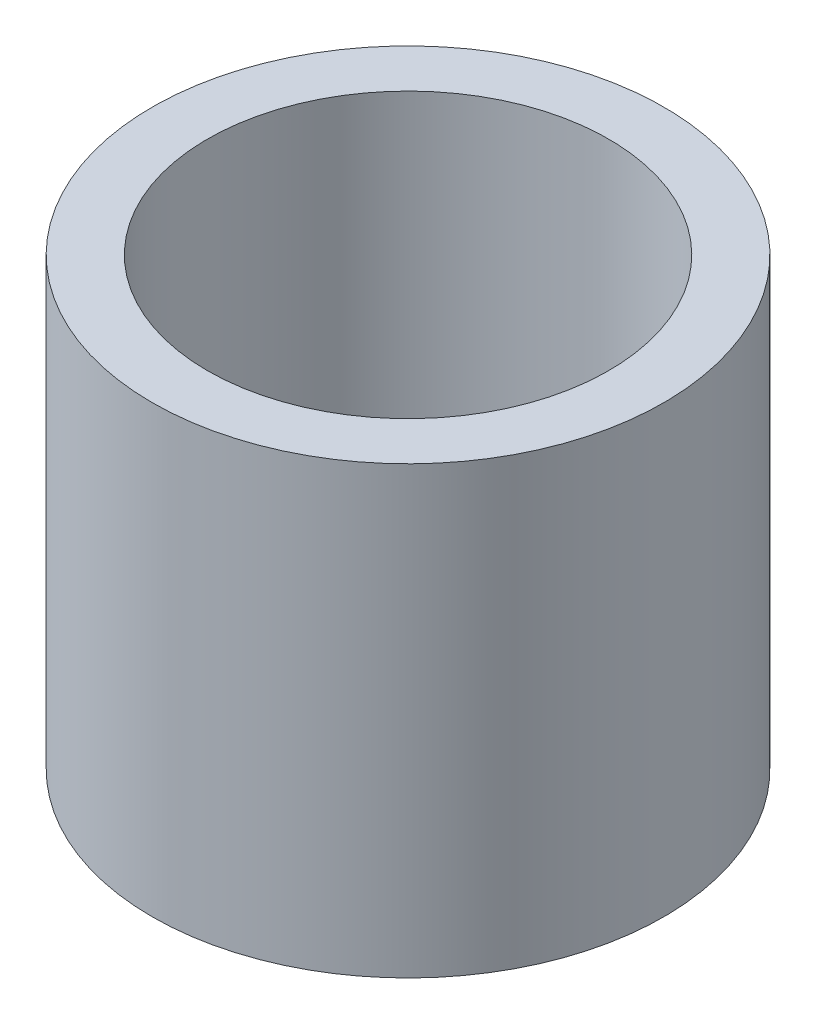
from build123d import *

# Parameters (mm, degrees)
SKETCH1_R           = 3.175
SKETCH1_R_2         = 2.4892
BOSS_EXTRUDE1_DEPTH = 5.525


with BuildPart() as part:
    # Sketch1 → Boss-Extrude1 (new body)
    with BuildSketch(Plane(origin=(0, 0, 0), x_dir=(1, 0, 0), z_dir=(0, 1, 0))):
        Circle(SKETCH1_R)
        Circle(SKETCH1_R_2, mode=Mode.SUBTRACT)
    extrude(amount=BOSS_EXTRUDE1_DEPTH)


solid = part.part
